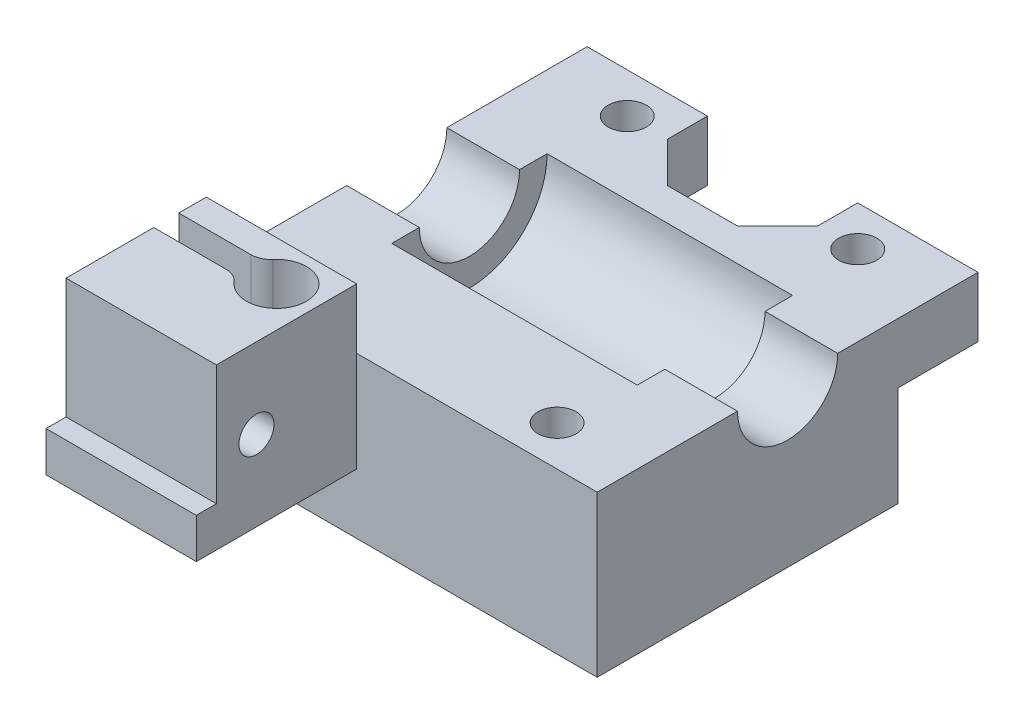
from build123d import *
from build123d.topology import SkipClean

# Parameters (mm, degrees)
SKETCH1_W                 = 31
SKETCH1_H                 = 22
BOSS_EXTRUDE1_DEPTH       = 11
SKETCH2_W                 = 31
SKETCH2_H                 = 22
SKETCH2_R                 = 7.843750423
BOSS_EXTRUDE2_DEPTH       = 5
SKETCH3_W                 = 24.5
SKETCH3_H                 = 15.5
CUT_EXTRUDE1_DEPTH        = 7.75
FILLET1_R                 = 7.75
CUT_EXTRUDE2_DEPTH        = 32.812929761
CUT_EXTRUDE2_DEPTH_BACK   = 32.812929761
SKETCH4_R                 = 5
SKETCH5_W                 = 8
SKETCH5_H                 = 8
SKETCH5_R                 = 1.905800151
BOSS_EXTRUDE3_DEPTH       = 6
CUT_EXTRUDE3_START        = -3
SKETCH6_R                 = 3
SKETCH6_R_2               = 1.905800151
CUT_EXTRUDE3_DEPTH        = 3
MIRROR9_COPY_1_SKETCH_W   = 8
MIRROR9_COPY_1_SKETCH_H   = 8
MIRROR9_COPY_1_SKETCH_R   = 1.905800151
MIRROR9_COPY_1_DEPTH      = 6
MIRROR9_START             = -3
MIRROR9_COPY_2_SKETCH_R   = 3
MIRROR9_COPY_2_SKETCH_R_2 = 1.905800151
MIRROR9_COPY_2_DEPTH      = 3
CHAMFER2_SIZE             = 4
SKETCH8_R                 = 3
BOSS_EXTRUDE4_DEPTH       = 16
SKETCH9_R                 = 1.75
BOSS_EXTRUDE5_DEPTH       = 16
CUT_EXTRUDE6_DEPTH        = 9
SKETCH11_R                = 1.75
CUT_EXTRUDE7_DEPTH        = 8
FILLET2_R                 = 2
CUT_EXTRUDE8_DEPTH        = 41.425858061
CUT_EXTRUDE8_DEPTH_BACK   = 41.425858061
SKETCH12_R                = 1.75
CUT_EXTRUDE9_START        = -3
SKETCH13_R                = 1.75
CUT_EXTRUDE9_DEPTH        = 3
BOSS_EXTRUDE8_DEPTH       = 4
BOSS_EXTRUDE9_DEPTH       = 4
CUT_EXTRUDE11_START       = -5
SKETCH18_R                = 1.75
CUT_EXTRUDE11_DEPTH       = 5
SKETCH20_W                = 15
SKETCH20_H                = 2
CUT_EXTRUDE12_DEPTH       = 12


with BuildPart() as part:
    # Sketch1 → Boss-Extrude1 (new body)
    with BuildSketch(Plane(origin=(0, 0, 0), x_dir=(1, 0, 0), z_dir=(0, 1, 0))):
        Rectangle(SKETCH1_W, SKETCH1_H)
    extrude(amount=BOSS_EXTRUDE1_DEPTH)

    # Sketch2 → Boss-Extrude2 (add)
    with BuildSketch(Plane(origin=(0, 0, 0), x_dir=(1, 0, 0), z_dir=(0, 1, 0))):
        Rectangle(SKETCH2_W, SKETCH2_H)
        with Locations(Location((0, 0, 0), (0, 0, 270))):
            Circle(SKETCH2_R, mode=Mode.SUBTRACT)
    extrude(amount=-BOSS_EXTRUDE2_DEPTH)

    # Sketch3 → Cut-Extrude1 (cut)
    with BuildSketch(Plane(origin=(0, 11, 0), x_dir=(1, 0, 0), z_dir=(0, 1, 0))):
        Rectangle(SKETCH3_W, SKETCH3_H)
    extrude(amount=-CUT_EXTRUDE1_DEPTH, mode=Mode.SUBTRACT)

    # Fillet1
    fillet1_edges = [part.edges().sort_by_distance(p)[0] for p in [
        (0, 3.25, 7.75),
        (0, 3.25, -7.75),
    ]]
    fillet(fillet1_edges, radius=FILLET1_R - 0.0001)  # a hair under: the kernel refuses the full size

    # Sketch4 → Cut-Extrude2 (cut, two sides: drawn at the far end of the back side and taken through both)
    with BuildSketch(Plane(origin=(-12.25, 0, 0), x_dir=(0, 0, -1), z_dir=(1, 0, 0)).offset(-CUT_EXTRUDE2_DEPTH_BACK)):
        with Locations((0, 11)):
            Circle(SKETCH4_R)
    extrude(amount=CUT_EXTRUDE2_DEPTH + CUT_EXTRUDE2_DEPTH_BACK, mode=Mode.SUBTRACT)

    # Sketch5 → Boss-Extrude3 (add)
    with BuildSketch(Plane(origin=(0, 11, 0), x_dir=(1, 0, 0), z_dir=(0, 1, 0))):
        with Locations((11.5, -15)):
            Rectangle(SKETCH5_W, SKETCH5_H)
        with Locations(Location((11.5, -15, 0), (0, 0, 270))):
            Circle(SKETCH5_R, mode=Mode.SUBTRACT)
    boss_extrude3 = extrude(amount=-BOSS_EXTRUDE3_DEPTH)

    # Sketch6 → Cut-Extrude3 (cut)
    with BuildSketch(Plane.XZ.offset(-5).offset(CUT_EXTRUDE3_START)):
        with Locations(Location((11.5, 15, 0), (0, 0, 270))):
            Circle(SKETCH6_R)
        with Locations(Location((11.5, 15, 0), (0, 0, 90))):
            Circle(SKETCH6_R_2, mode=Mode.SUBTRACT)
    cut_extrude3 = extrude(amount=CUT_EXTRUDE3_DEPTH, mode=Mode.SUBTRACT)

    # Mirror8: Boss-Extrude3, Cut-Extrude3 across plane
    add(boss_extrude3.mirror(Plane(origin=(0, 0, 0), x_dir=(0, 0, 1), z_dir=(1, 0, 0))))
    add(cut_extrude3.mirror(Plane(origin=(0, 0, 0), x_dir=(0, 0, 1), z_dir=(1, 0, 0))), mode=Mode.SUBTRACT)

    # Mirror9: Boss-Extrude3, Cut-Extrude3 across plane
    add(boss_extrude3.mirror(Plane.XY))
    add(cut_extrude3.mirror(Plane.XY), mode=Mode.SUBTRACT)

    # Mirror9 copy 1 sketch → Mirror9 copy 1 (add)
    with BuildSketch(Plane(origin=(0, 11, 0), x_dir=(-1, 0, 0), z_dir=(0, 1, 0))):
        with Locations((11.5, -15)):
            Rectangle(MIRROR9_COPY_1_SKETCH_W, MIRROR9_COPY_1_SKETCH_H)
        with Locations(Location((11.5, -15, 0), (0, 0, 270))):
            Circle(MIRROR9_COPY_1_SKETCH_R, mode=Mode.SUBTRACT)
    extrude(amount=-MIRROR9_COPY_1_DEPTH)

    # Mirror9 copy 2 sketch → Mirror9 copy 2 (cut)
    with BuildSketch(Plane(origin=(0, 5, 0), x_dir=(-1, 0, 0), z_dir=(0, -1, 0)).offset(MIRROR9_START)):
        with Locations(Location((11.5, 15, 0), (0, 0, 270))):
            Circle(MIRROR9_COPY_2_SKETCH_R)
        with Locations(Location((11.5, 15, 0), (0, 0, 90))):
            Circle(MIRROR9_COPY_2_SKETCH_R_2, mode=Mode.SUBTRACT)
    extrude(amount=MIRROR9_COPY_2_DEPTH, mode=Mode.SUBTRACT)

    # Chamfer2
    chamfer2_edges = [part.edges().sort_by_distance(p)[0] for p in [
        (-7.5, 8, -11),
        (7.5, 8, -11),
        (7.5, 8, 11),
        (-7.5, 8, 11),
    ]]
    chamfer(chamfer2_edges, length=CHAMFER2_SIZE)

    # Sketch8 → Boss-Extrude4 (add)
    # profile 1 of 3: a face of its own
    with BuildSketch(Plane(origin=(0, 11, 0), x_dir=(1, 0, 0), z_dir=(0, 1, 0))):
        Polygon((3.5, -11), (-3.5, -11), (-7.5, -15), (-7.5, -19), (7.5, -19), (7.5, -15), align=None)
    # profile 2 of 3: a face of its own
    with BuildSketch(Plane(origin=(0, 11, 0), x_dir=(1, 0, 0), z_dir=(0, 1, 0))):
        Polygon((15.5, -11), (3.5, -11), (7.5, -15), (7.5, -19), (15.5, -19), align=None)
        with Locations(Location((11.5, -15, 0), (0, 0, 90))):
            Circle(SKETCH8_R, mode=Mode.SUBTRACT)
    # profile 3 of 3: a face of its own
    with BuildSketch(Plane(origin=(0, 11, 0), x_dir=(1, 0, 0), z_dir=(0, 1, 0))):
        Polygon((-3.5, -11), (-15.5, -11), (-15.5, -19), (-7.5, -19), (-7.5, -15), align=None)
        with Locations(Location((-11.5, -15, 0), (0, 0, 90))):
            Circle(SKETCH8_R, mode=Mode.SUBTRACT)
    extrude(amount=-BOSS_EXTRUDE4_DEPTH)

    # Sketch9 → Boss-Extrude5 (add)
    with BuildSketch(Plane.ZY.offset(15.5)):
        Polygon((19, 11), (19, 1), (35, 1), (35, 17), (19, 17), align=None)
        with Locations((29, 9)):
            Circle(SKETCH9_R, mode=Mode.SUBTRACT)
    extrude(amount=-BOSS_EXTRUDE5_DEPTH)

    # Sketch10 → Cut-Extrude6 (cut)
    with BuildSketch(Plane(origin=(0, 17, 0), x_dir=(1, 0, 0), z_dir=(0, 1, 0))):
        with BuildLine():
            ThreePointArc((-11.227178029, -24.25), (-11.5, -23), (-11.227178029, -21.75))
            Line((-11.227178029, -21.75), (-15.5, -21.75))
            Line((-15.5, -21.75), (-15.5, -24.25))
            Line((-15.5, -24.25), (-11.227178029, -24.25))
        make_face()
        with BuildLine():
            Line((-8.5, -24.25), (-8.5, -21.75))
            Line((-8.5, -21.75), (-11.227178029, -21.75))
            ThreePointArc((-11.227178029, -21.75), (-11.5, -23), (-11.227178029, -24.25))
            Line((-11.227178029, -24.25), (-8.5, -24.25))
        make_face()
        with BuildLine():
            Line((-11.227178029, -21.75), (-8.5, -21.75))
            Line((-8.5, -21.75), (-8.5, -24.25))
            Line((-8.5, -24.25), (-11.227178029, -24.25))
            ThreePointArc((-11.227178029, -24.25), (-7.860286817, -25.931001031), (-5.5, -23))
            ThreePointArc((-5.5, -23), (-7.860286817, -20.068998969), (-11.227178029, -21.75))
        make_face()
    extrude(amount=-CUT_EXTRUDE6_DEPTH, mode=Mode.SUBTRACT)

    # Sketch11 → Cut-Extrude7 (cut)
    with BuildSketch(Plane.ZY.offset(15.5)):
        Polygon((29, 12.175426481), (26.25, 10.58771324), (26.25, 7.41228676), (29, 5.824573519), (31.75, 7.41228676), (31.75, 10.58771324), align=None)
        with Locations((29, 9)):
            Circle(SKETCH11_R, mode=Mode.SUBTRACT)
    extrude(amount=-CUT_EXTRUDE7_DEPTH, mode=Mode.SUBTRACT)

    # Fillet2
    fillet2_edges = [part.edges().sort_by_distance(p)[0] for p in [
        (-11.227178029, 12.5, 21.75),
        (-11.227178029, 12.5, 24.25),
    ]]
    fillet(fillet2_edges, radius=FILLET2_R)

    # Sketch12 → Cut-Extrude8 (cut, two sides: drawn at the far end of the back side and taken through both)
    with BuildSketch(Plane(origin=(0, 8, 0), x_dir=(1, 0, 0), z_dir=(0, 1, 0)).offset(-CUT_EXTRUDE8_DEPTH_BACK)):
        with Locations(Location((-8.5, -23, 0), (0, 0, 90))):
            Circle(SKETCH12_R)
    extrude(amount=CUT_EXTRUDE8_DEPTH + CUT_EXTRUDE8_DEPTH_BACK, mode=Mode.SUBTRACT)

    # Sketch13 → Cut-Extrude9 (cut)
    with BuildSketch(Plane.XZ.offset(-1).offset(CUT_EXTRUDE9_START)):
        Polygon((-5.324573519, 23), (-6.91228676, 25.75), (-10.08771324, 25.75), (-11.675426481, 23), (-10.08771324, 20.25), (-6.91228676, 20.25), align=None)
        with Locations(Location((-8.5, 23, 0), (0, 0, 270))):
            Circle(SKETCH13_R, mode=Mode.SUBTRACT)
    extrude(amount=CUT_EXTRUDE9_DEPTH, mode=Mode.SUBTRACT)

    # Sketch15 → Boss-Extrude8 (add)
    with SkipClean():  # the faces are left unmerged after this step: merging them gives an invalid solid
        with BuildSketch(Plane.ZY.offset(15.5)):
            with BuildLine():
                Line((24.25, 17), (24.25, 8))
                Line((24.25, 8), (21.75, 8))
                Line((21.75, 8), (21.75, 17))
                Line((21.75, 17), (19, 17))
                Line((19, 17), (19, 11))
                Line((19, 11), (5, 11))
                ThreePointArc((5, 11), (0, 6), (-5, 11))
                Line((-5, 11), (-19, 11))
                Line((-19, 11), (-19, 5))
                Line((-19, 5), (-11, 5))
                Line((-11, 5), (-11, -5))
                Line((-11, -5), (19, -5))
                Line((19, -5), (19, 1))
                Line((19, 1), (35, 1))
                Line((35, 1), (35, 17))
                Line((35, 17), (24.25, 17))
            make_face()
            Polygon((29, 12.175426481), (26.25, 10.58771324), (26.25, 7.41228676), (29, 5.824573519), (31.75, 7.41228676), (31.75, 10.58771324), align=None, mode=Mode.SUBTRACT)
        extrude(amount=BOSS_EXTRUDE8_DEPTH)
    add(part.part.scale(1), mode=Mode.REPLACE)  # the faces are merged on a copy

    # Sketch17 → Boss-Extrude9 (add)
    with BuildSketch(Plane(origin=(15.5, 0, 0), x_dir=(0, 0, -1), z_dir=(1, 0, 0))):
        with BuildLine():
            Line((-5, 11), (-19, 11))
            Line((-19, 11), (-19, -5))
            Line((-19, -5), (11, -5))
            Line((11, -5), (11, 5))
            Line((11, 5), (19, 5))
            Line((19, 5), (19, 11))
            Line((19, 11), (5, 11))
            ThreePointArc((5, 11), (0, 6), (-5, 11))
        make_face()
    extrude(amount=BOSS_EXTRUDE9_DEPTH)

    # Sketch18 → Cut-Extrude11 (cut)
    with BuildSketch(Plane(origin=(0.5, 0, 0), x_dir=(0, 0, -1), z_dir=(1, 0, 0)).offset(CUT_EXTRUDE11_START)):
        Polygon((-35, 1), (-19, 1), (-19, 11), (-19, 17), (-35, 17), align=None)
        with Locations(Location((-29, 9, 0), (0, 0, 180))):
            Circle(SKETCH18_R, mode=Mode.SUBTRACT)
    extrude(amount=CUT_EXTRUDE11_DEPTH, mode=Mode.SUBTRACT)

    # Sketch20 → Cut-Extrude12 (cut)
    with BuildSketch(Plane(origin=(0, 17, 0), x_dir=(1, 0, 0), z_dir=(0, 1, 0))):
        with Locations((-12, -34)):
            Rectangle(SKETCH20_W, SKETCH20_H)
    extrude(amount=-CUT_EXTRUDE12_DEPTH, mode=Mode.SUBTRACT)


solid = part.part
